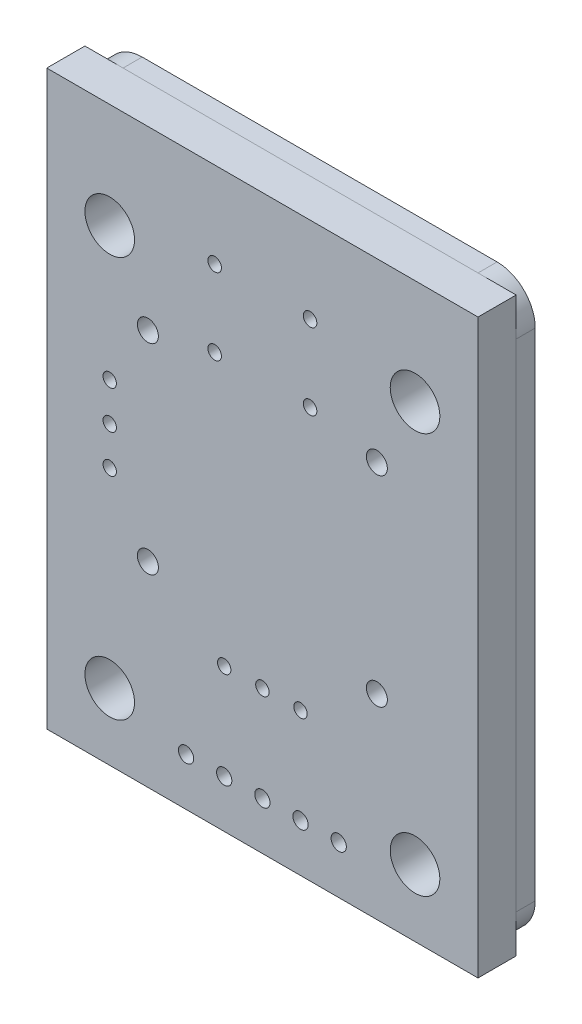
from build123d import *

# Parameters (mm, degrees)
SKETCH1_W           = 28.702
SKETCH1_H           = 38.1
SKETCH1_R           = 1.651001197
SKETCH1_R_2         = 0.699000433
SKETCH1_R_3         = 0.450000167
SKETCH1_R_4         = 0.444999896
SKETCH1_R_5         = 0.698999967
SKETCH1_R_6         = 0.445000129
SKETCH1_R_7         = 0.445000362
SKETCH1_R_8         = 0.508000026
BOSS_EXTRUDE1_DEPTH = 2.54
SKETCH2_W           = 28.702
SKETCH2_H           = 38.1
SKETCH2_R           = 1.651001197
SKETCH2_R_2         = 1.449000433
SKETCH2_R_3         = 1.448999967
SKETCH2_R_4         = 0.950000167
SKETCH2_R_5         = 0.945000129
SKETCH2_R_6         = 0.945000362
SKETCH2_R_7         = 1.008000026
SKETCH2_R_8         = 0.944999896
BOSS_EXTRUDE2_DEPTH = 1.27
FILLET1_R           = 2.54


# Read off the part's stored shape, not the designer's step: Surface-Imported1
with BuildPart() as part:
    # Sketch1 → Boss-Extrude1 (new body)
    with BuildSketch(Plane(origin=(0, 0, -0.79999998), x_dir=(-1, 0, 0), z_dir=(0, 0, -1))):
        with Locations((-12.699999847, 17.145000507)):
            Rectangle(SKETCH1_W, SKETCH1_H)
        with Locations((-22.85999991, 29.209999368)):
            Circle(SKETCH1_R, mode=Mode.SUBTRACT)
        with Locations(Location((-2.539999783, 29.209999368, 0), (0, 0, 180))):
            Circle(SKETCH1_R, mode=Mode.SUBTRACT)
        with Locations((-2.539999783, 2.540001646)):
            Circle(SKETCH1_R, mode=Mode.SUBTRACT)
        with Locations(Location((-22.85999991, 2.540001646, 0), (0, 0, 180))):
            Circle(SKETCH1_R, mode=Mode.SUBTRACT)
        with Locations((-20.320000127, 24.447999895)):
            Circle(SKETCH1_R_2, mode=Mode.SUBTRACT)
        with Locations((-15.875000507, 30.479999259)):
            Circle(SKETCH1_R_3, mode=Mode.SUBTRACT)
        with Locations((-15.875000507, 25.399999693)):
            Circle(SKETCH1_R_3, mode=Mode.SUBTRACT)
        with Locations(Location((-9.524999186, 30.479999259, 0), (0, 0, 180))):
            Circle(SKETCH1_R_3, mode=Mode.SUBTRACT)
        with Locations(Location((-9.524999186, 25.399999693, 0), (0, 0, 180))):
            Circle(SKETCH1_R_3, mode=Mode.SUBTRACT)
        with Locations(Location((-5.079999566, 24.447999895, 0), (0, 0, 180))):
            Circle(SKETCH1_R_2, mode=Mode.SUBTRACT)
        with Locations((-2.540000016, 20.319999196)):
            Circle(SKETCH1_R_4, mode=Mode.SUBTRACT)
        with Locations((-2.540000016, 17.779999413)):
            Circle(SKETCH1_R_4, mode=Mode.SUBTRACT)
        with Locations((-2.540000016, 15.23999963)):
            Circle(SKETCH1_R_4, mode=Mode.SUBTRACT)
        with Locations((-5.080000032, 11.112999637)):
            Circle(SKETCH1_R_5, mode=Mode.SUBTRACT)
        with Locations(Location((-20.319999661, 11.112999637, 0), (0, 0, 180))):
            Circle(SKETCH1_R_5, mode=Mode.SUBTRACT)
        with Locations((-15.23999963, 7.620000048)):
            Circle(SKETCH1_R_6, mode=Mode.SUBTRACT)
        with Locations(Location((-10.160000063, 7.620000048, 0), (0, 0, 180))):
            Circle(SKETCH1_R_6, mode=Mode.SUBTRACT)
        with Locations((-12.699999847, 7.619999815)):
            Circle(SKETCH1_R_7, mode=Mode.SUBTRACT)
        with Locations((-17.780000344, 1.270000008)):
            Circle(SKETCH1_R_8, mode=Mode.SUBTRACT)
        with Locations((-15.23999963, 1.270000008)):
            Circle(SKETCH1_R_8, mode=Mode.SUBTRACT)
        with Locations((-12.699999847, 1.270000008)):
            Circle(SKETCH1_R_8, mode=Mode.SUBTRACT)
        with Locations(Location((-7.619999349, 1.270000008, 0), (0, 0, 180))):
            Circle(SKETCH1_R_8, mode=Mode.SUBTRACT)
        with Locations(Location((-10.160000063, 1.270000008, 0), (0, 0, 180))):
            Circle(SKETCH1_R_8, mode=Mode.SUBTRACT)
    extrude(amount=BOSS_EXTRUDE1_DEPTH)


with BuildPart() as body_2:
    # Sketch2 → Boss-Extrude2 (new body)
    with BuildSketch(Plane(origin=(0, 0, -3.33999998), x_dir=(-1, 0, 0), z_dir=(0, 0, -1))):
        with Locations((-12.699999847, 17.145000507)):
            Rectangle(SKETCH2_W, SKETCH2_H)
        with Locations((-2.539999783, 2.540001646)):
            Circle(SKETCH2_R, mode=Mode.SUBTRACT)
        with Locations((-22.85999991, 2.540001646)):
            Circle(SKETCH2_R, mode=Mode.SUBTRACT)
        with Locations((-2.539999783, 29.209999368)):
            Circle(SKETCH2_R, mode=Mode.SUBTRACT)
        with Locations((-22.85999991, 29.209999368)):
            Circle(SKETCH2_R, mode=Mode.SUBTRACT)
        with Locations((-20.320000127, 24.447999895)):
            Circle(SKETCH2_R_2, mode=Mode.SUBTRACT)
        with Locations((-5.079999566, 24.447999895)):
            Circle(SKETCH2_R_2, mode=Mode.SUBTRACT)
        with Locations((-5.080000032, 11.112999637)):
            Circle(SKETCH2_R_3, mode=Mode.SUBTRACT)
        with Locations((-20.319999661, 11.112999637)):
            Circle(SKETCH2_R_3, mode=Mode.SUBTRACT)
        with Locations((-15.875000507, 30.479999259)):
            Circle(SKETCH2_R_4, mode=Mode.SUBTRACT)
        with Locations((-9.524999186, 30.479999259)):
            Circle(SKETCH2_R_4, mode=Mode.SUBTRACT)
        with Locations((-15.875000507, 25.399999693)):
            Circle(SKETCH2_R_4, mode=Mode.SUBTRACT)
        with Locations((-9.524999186, 25.399999693)):
            Circle(SKETCH2_R_4, mode=Mode.SUBTRACT)
        with Locations((-15.23999963, 7.620000048)):
            Circle(SKETCH2_R_5, mode=Mode.SUBTRACT)
        with Locations((-12.699999847, 7.619999815)):
            Circle(SKETCH2_R_6, mode=Mode.SUBTRACT)
        with Locations((-10.160000063, 7.620000048)):
            Circle(SKETCH2_R_5, mode=Mode.SUBTRACT)
        with Locations((-17.780000344, 1.270000008)):
            Circle(SKETCH2_R_7, mode=Mode.SUBTRACT)
        with Locations((-15.23999963, 1.270000008)):
            Circle(SKETCH2_R_7, mode=Mode.SUBTRACT)
        with Locations((-12.699999847, 1.270000008)):
            Circle(SKETCH2_R_7, mode=Mode.SUBTRACT)
        with Locations((-10.160000063, 1.270000008)):
            Circle(SKETCH2_R_7, mode=Mode.SUBTRACT)
        with Locations((-7.619999349, 1.270000008)):
            Circle(SKETCH2_R_7, mode=Mode.SUBTRACT)
        with Locations((-2.540000016, 15.23999963)):
            Circle(SKETCH2_R_8, mode=Mode.SUBTRACT)
        with Locations((-2.540000016, 17.779999413)):
            Circle(SKETCH2_R_8, mode=Mode.SUBTRACT)
        with Locations((-2.540000016, 20.319999196)):
            Circle(SKETCH2_R_8, mode=Mode.SUBTRACT)
    extrude(amount=BOSS_EXTRUDE2_DEPTH)

    # Fillet1
    fillet1_edges = [body_2.edges().sort_by_distance(p)[0] for p in [
        (27.050999847, -1.904999493, -3.97499998),
        (27.050999847, 36.195000507, -3.97499998),
        (-1.651000153, 36.195000507, -3.97499998),
        (-1.651000153, -1.904999493, -3.97499998),
    ]]
    fillet(fillet1_edges, radius=FILLET1_R)


solid = Compound([part.part, body_2.part])
